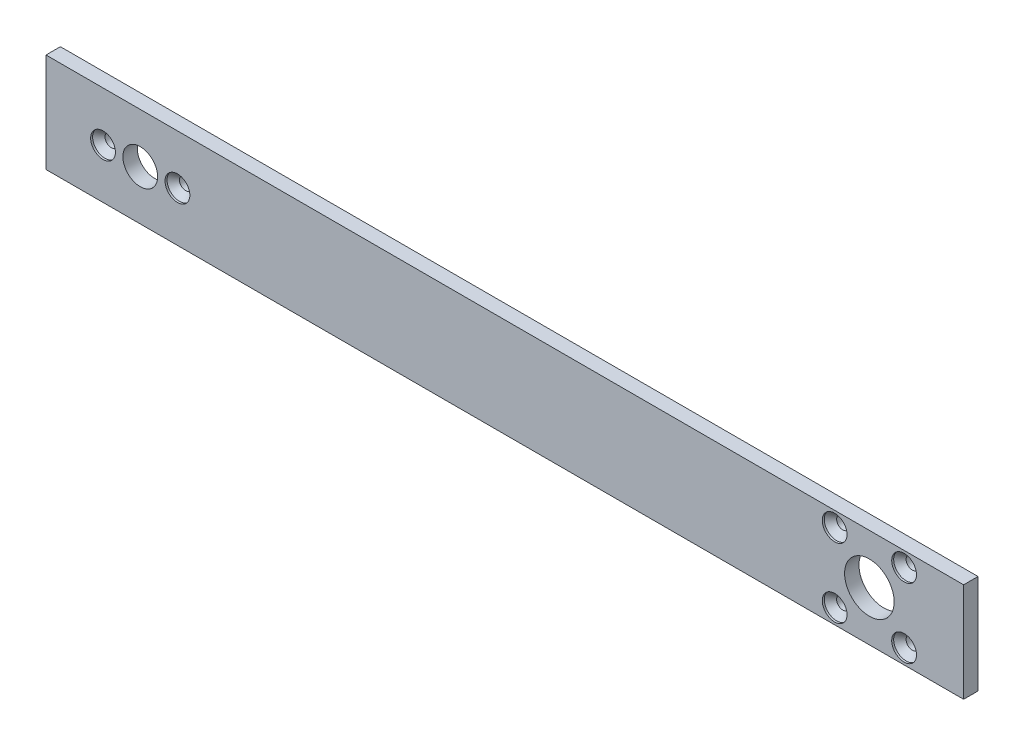
from build123d import *

# Parameters (mm, degrees)
SKETCH1_W                       = 185
SKETCH1_H                       = 20
BASE_SHAPE_DEPTH                = 2.9
MOTOR_CUTOUTS_REACH             = 95.084
SKETCH2_R                       = 1.25
SKETCH2_R_2                     = 3.5
SKETCH2_R_3                     = 5
COUNTERSUNK_CHAMFERS_AT_2_COUNT = 2
COUNTERSUNK_CHAMFERS_AT_2_PITCH = 15
COUNTERSUNK_CHAMFERS_AT_3_COUNT = 2
COUNTERSUNK_CHAMFERS_AT_3_PITCH = 147.666008275
COUNTERSUNK_CHAMFERS_AT_4_COUNT = 2
COUNTERSUNK_CHAMFERS_AT_4_PITCH = 161.651631603
COUNTERSUNK_CHAMFERS_AT_5_COUNT = 2
COUNTERSUNK_CHAMFERS_AT_5_PITCH = 147.666008275
COUNTERSUNK_CHAMFERS_AT_6_COUNT = 2
COUNTERSUNK_CHAMFERS_AT_6_PITCH = 161.651631603
PCB_SLOT_DEPTH                  = 0.775


with BuildPart() as part:
    # Sketch1 → Base shape (new body)
    with BuildSketch(Plane.XY):
        Rectangle(SKETCH1_W, SKETCH1_H)
    extrude(amount=-BASE_SHAPE_DEPTH)

    # Sketch2 → Motor cutouts (cut, up to next)
    with BuildSketch(Plane.XY, mode=Mode.PRIVATE) as motor_cutouts_sk1:
        with Locations((-81, 0)):
            Circle(SKETCH2_R)
    motor_cutouts_tool1 = extrude(motor_cutouts_sk1.sketch, amount=-MOTOR_CUTOUTS_REACH, mode=Mode.PRIVATE) & part.part
    # Sketch2 → Motor cutouts (cut, up to next)
    with BuildSketch(Plane.XY, mode=Mode.PRIVATE) as motor_cutouts_sk2:
        with Locations((-66, 0)):
            Circle(SKETCH2_R)
    motor_cutouts_tool2 = extrude(motor_cutouts_sk2.sketch, amount=-MOTOR_CUTOUTS_REACH, mode=Mode.PRIVATE) & part.part
    # Sketch2 → Motor cutouts (cut, up to next)
    with BuildSketch(Plane.XY, mode=Mode.PRIVATE) as motor_cutouts_sk3:
        with Locations((-73.5, 0)):
            Circle(SKETCH2_R_2)
    motor_cutouts_tool3 = extrude(motor_cutouts_sk3.sketch, amount=-MOTOR_CUTOUTS_REACH, mode=Mode.PRIVATE) & part.part
    # Sketch2 → Motor cutouts (cut, up to next)
    with BuildSketch(Plane.XY, mode=Mode.PRIVATE) as motor_cutouts_sk4:
        with Locations((73.5, 0)):
            Circle(SKETCH2_R_3)
    motor_cutouts_tool4 = extrude(motor_cutouts_sk4.sketch, amount=-MOTOR_CUTOUTS_REACH, mode=Mode.PRIVATE) & part.part
    # Sketch2 → Motor cutouts (cut, up to next)
    with BuildSketch(Plane.XY, mode=Mode.PRIVATE) as motor_cutouts_sk5:
        with Locations((66.5, 7)):
            Circle(SKETCH2_R)
    motor_cutouts_tool5 = extrude(motor_cutouts_sk5.sketch, amount=-MOTOR_CUTOUTS_REACH, mode=Mode.PRIVATE) & part.part
    # Sketch2 → Motor cutouts (cut, up to next)
    with BuildSketch(Plane.XY, mode=Mode.PRIVATE) as motor_cutouts_sk6:
        with Locations((80.5, 7)):
            Circle(SKETCH2_R)
    motor_cutouts_tool6 = extrude(motor_cutouts_sk6.sketch, amount=-MOTOR_CUTOUTS_REACH, mode=Mode.PRIVATE) & part.part
    # Sketch2 → Motor cutouts (cut, up to next)
    with BuildSketch(Plane.XY, mode=Mode.PRIVATE) as motor_cutouts_sk7:
        with Locations((80.5, -7)):
            Circle(SKETCH2_R)
    motor_cutouts_tool7 = extrude(motor_cutouts_sk7.sketch, amount=-MOTOR_CUTOUTS_REACH, mode=Mode.PRIVATE) & part.part
    # Sketch2 → Motor cutouts (cut, up to next)
    with BuildSketch(Plane.XY, mode=Mode.PRIVATE) as motor_cutouts_sk8:
        with Locations((66.5, -7)):
            Circle(SKETCH2_R)
    motor_cutouts_tool8 = extrude(motor_cutouts_sk8.sketch, amount=-MOTOR_CUTOUTS_REACH, mode=Mode.PRIVATE) & part.part
    add(motor_cutouts_tool1.solids().sort_by_distance((-81, 0, 0))[0], mode=Mode.SUBTRACT)
    add(motor_cutouts_tool2.solids().sort_by_distance((-66, 0, 0))[0], mode=Mode.SUBTRACT)
    add(motor_cutouts_tool3.solids().sort_by_distance((-73.5, 0, 0))[0], mode=Mode.SUBTRACT)
    add(motor_cutouts_tool4.solids().sort_by_distance((73.5, 0, 0))[0], mode=Mode.SUBTRACT)
    add(motor_cutouts_tool5.solids().sort_by_distance((66.5, 7, 0))[0], mode=Mode.SUBTRACT)
    add(motor_cutouts_tool6.solids().sort_by_distance((80.5, 7, 0))[0], mode=Mode.SUBTRACT)
    add(motor_cutouts_tool7.solids().sort_by_distance((80.5, -7, 0))[0], mode=Mode.SUBTRACT)
    add(motor_cutouts_tool8.solids().sort_by_distance((66.5, -7, 0))[0], mode=Mode.SUBTRACT)

    # Sketch4 → Countersunk chamfers (revolve, cut)
    with BuildSketch(Plane(origin=(-81, 0, 0), x_dir=(0, -1, 0), z_dir=(1, 0, 0))):
        Polygon((0, 0), (0, 2.9), (1.25, 2.9), (1.25, 1.65), (2.5, 0.4), (2.5, 0), align=None)
    countersunk_chamfers = revolve(axis=Axis((-81, 0, 6.35), (0, 0, -1)), mode=Mode.SUBTRACT)

    # Countersunk chamfers at 2: Countersunk chamfers ×2
    with Locations(*[(i * COUNTERSUNK_CHAMFERS_AT_2_PITCH, 0, 0) for i in range(1, COUNTERSUNK_CHAMFERS_AT_2_COUNT)]):
        add(countersunk_chamfers, mode=Mode.SUBTRACT)

    # Countersunk chamfers at 3: Countersunk chamfers ×2
    with Locations(*[Vector(0.9988757854473691, 0.047404274563603965, 0) * (i * COUNTERSUNK_CHAMFERS_AT_3_PITCH) for i in range(1, COUNTERSUNK_CHAMFERS_AT_3_COUNT)]):
        add(countersunk_chamfers, mode=Mode.SUBTRACT)

    # Countersunk chamfers at 4: Countersunk chamfers ×2
    with Locations(*[Vector(0.9990619853213468, 0.043302996267798335, 0) * (i * COUNTERSUNK_CHAMFERS_AT_4_PITCH) for i in range(1, COUNTERSUNK_CHAMFERS_AT_4_COUNT)]):
        add(countersunk_chamfers, mode=Mode.SUBTRACT)

    # Countersunk chamfers at 5: Countersunk chamfers ×2
    with Locations(*[Vector(0.9988757854473691, -0.04740427456360395, 0) * (i * COUNTERSUNK_CHAMFERS_AT_5_PITCH) for i in range(1, COUNTERSUNK_CHAMFERS_AT_5_COUNT)]):
        add(countersunk_chamfers, mode=Mode.SUBTRACT)

    # Countersunk chamfers at 6: Countersunk chamfers ×2
    with Locations(*[Vector(0.9990619853213468, -0.0433029962677983, 0) * (i * COUNTERSUNK_CHAMFERS_AT_6_PITCH) for i in range(1, COUNTERSUNK_CHAMFERS_AT_6_COUNT)]):
        add(countersunk_chamfers, mode=Mode.SUBTRACT)

    # Sketch5 → PCB slot (cut)
    with BuildSketch(Plane(origin=(0, 0, -2.9), x_dir=(-1, 0, 0), z_dir=(0, 0, -1))):
        with BuildLine():
            Line((-60, -6), (60, -6))
            ThreePointArc((60, -6), (61, -7), (60, -8))
            Line((60, -8), (-60, -8))
            ThreePointArc((-60, -8), (-61, -7), (-60, -6))
        make_face()
    extrude(amount=-PCB_SLOT_DEPTH, mode=Mode.SUBTRACT)


solid = part.part
